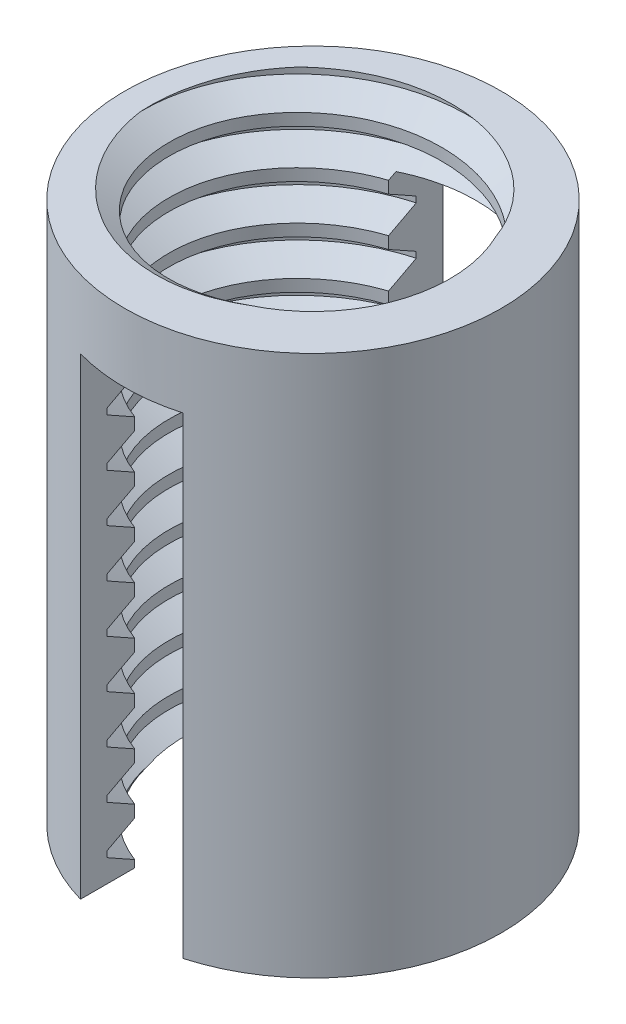
from build123d import *

# Parameters (mm, degrees)
SKETCH1_R           = 2.75
SKETCH1_R_2         = 2
BOSS_EXTRUDE1_DEPTH = 7.9
SKETCH2_W           = 1.5
SKETCH2_H           = 5.5
CUT_EXTRUDE1_DEPTH  = 6.9
THREAD1_PITCH       = 0.7


with BuildPart() as part:
    # Sketch1 → Boss-Extrude1 (new body)
    with BuildSketch(Plane(origin=(0, 0, 0), x_dir=(1, 0, 0), z_dir=(0, 1, 0))):
        with Locations(Location((0, 0, 0), (0, 0, 270))):
            Circle(SKETCH1_R)
        with Locations(Location((0, 0, 0), (0, 0, 270))):
            Circle(SKETCH1_R_2, mode=Mode.SUBTRACT)
    extrude(amount=BOSS_EXTRUDE1_DEPTH)

    # Sketch2 → Cut-Extrude1 (cut)
    with BuildSketch(Plane.XZ):
        Rectangle(SKETCH2_W, SKETCH2_H)
    extrude(amount=-CUT_EXTRUDE1_DEPTH, mode=Mode.SUBTRACT)

    # Thread1: the profile of Thread Profile1 profile screwed along a right-hand helix of 14.285714 turns, 6 arcs to a turn; built about Z, then put on its axis
    thread1_z = Axis((0, 0, 0), (0, 0, 1))
    thread1_corners = [(1.9997, 0, -0.000173205), (2.378886113, 0, 0.218749999), (2.378886113, 0, 0.306249999), (1.9997, 0, 0.525173203)]
    with BuildLine(mode=Mode.PRIVATE) as thread1_profile:
        Line(thread1_corners[0], thread1_corners[1])
        Line(thread1_corners[1], thread1_corners[2])
        Line(thread1_corners[2], thread1_corners[3])
        Line(thread1_corners[3], thread1_corners[0])
    thread1_cap = Face(thread1_profile.wire())
    thread1_turn_angles = [0, 30, 60, 90, 120, 150, 180, 210, 240, 270, 300, 330, 360]
    thread1_turn_weights = [1, 0.8660254037844387, 1, 0.8660254037844387, 1, 0.8660254037844387, 1, 0.8660254037844387, 1, 0.8660254037844387, 1, 0.8660254037844387, 1]
    thread1_turn_rails = [Edge.make_bspline([Vector(p[0], p[1], 0).rotate(thread1_z, thread1_turn_angles[k]) / thread1_turn_weights[k] + Vector(0, 0, p[2] + THREAD1_PITCH * thread1_turn_angles[k] / 360) for k in range(13)], [0, 0, 0, 1, 1, 2, 2, 3, 3, 4, 4, 5, 5, 6, 6, 6], 2, thread1_turn_weights) for p in thread1_corners]
    thread1_turn_sides = [Face.make_surface_from_curves(thread1_turn_rails[p[0]], thread1_turn_rails[p[1]]) for p in [(0, 1), (1, 2), (2, 3), (3, 0)]]
    thread1_last_angles = [5040, 5070, 5100, 5121.428571429, 5142.857142857]
    thread1_last_weights = [1, 0.8660254037844387, 1, 0.9308737486442035, 1]
    thread1_last_rails = [Edge.make_bspline([Vector(p[0], p[1], 0).rotate(thread1_z, thread1_last_angles[k]) / thread1_last_weights[k] + Vector(0, 0, p[2] + THREAD1_PITCH * thread1_last_angles[k] / 360) for k in range(5)], [0, 0, 0, 1, 1, 2, 2, 2], 2, thread1_last_weights) for p in thread1_corners]
    thread1_last_sides = [Face.make_surface_from_curves(thread1_last_rails[p[0]], thread1_last_rails[p[1]]) for p in [(0, 1), (1, 2), (2, 3), (3, 0)]]
    thread1 = Plane(origin=(0, 8.9, 0), x_dir=(-1, 0, 0), z_dir=(0, -1, 0)) * Solid(Shell([*[p.moved(Location((0, 0, THREAD1_PITCH * i))) for i in range(14) for p in thread1_turn_sides], *thread1_last_sides, thread1_cap, thread1_cap.rotate(thread1_z, 5142.857142857).moved(Location((0, 0, THREAD1_PITCH * 5142.857142857 / 360)))]))
    add(thread1, mode=Mode.SUBTRACT)


solid = part.part
